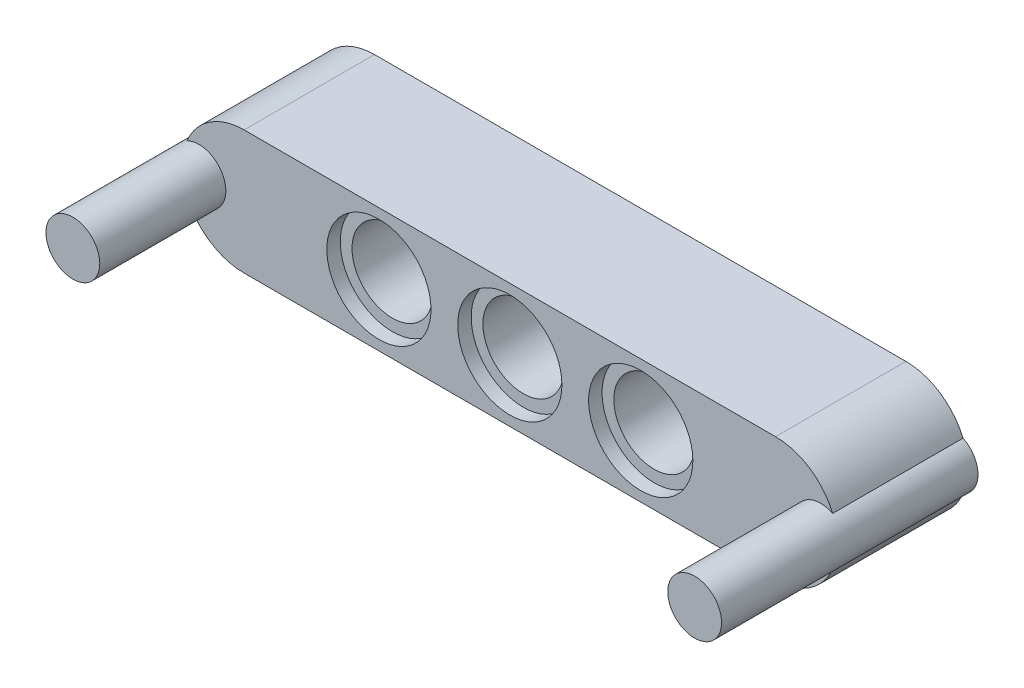
from build123d import *

# Parameters (mm, degrees)
SKETCH1_W                = 39
SKETCH1_H                = 7.38
BOSS_EXTRUDE1_DEPTH      = 7.76
SKETCH2_R                = 2.4
CUT_EXTRUDE1_DEPTH       = 7.76
CUT_EXTRUDE2_OUTLINE_R   = 3.1
CUT_EXTRUDE2_OUTLINE_R_2 = 2.4
CUT_EXTRUDE2_DEPTH       = 0.8
CUT_EXTRUDE3_START       = 6.96
CUT_EXTRUDE3_OUTLINE_R   = 3.1
CUT_EXTRUDE3_OUTLINE_R_2 = 2.4
CUT_EXTRUDE3_DEPTH       = 0.8
LPATTERN3_COUNT          = 3
LPATTERN3_PITCH          = 7.79
LPATTERN6_COUNT          = 3
LPATTERN6_PITCH          = 7.79
FILLET1_R                = 3.69
FILLET2_R                = 3.69
FILLET3_R                = 3.69
FILLET4_R                = 3.69
SKETCH3_R                = 3.1
BOSS_EXTRUDE2_DEPTH      = 7.76
BOSS_EXTRUDE3_START      = -7.76
SKETCH4_R                = 3.1
BOSS_EXTRUDE3_DEPTH      = 7.76
SKETCH6_R                = 1.6
BOSS_EXTRUDE4_DEPTH      = 7.5
SKETCH10_R               = 1.6
BOSS_EXTRUDE5_DEPTH      = 8


# Read off the part's stored shape, not the designer's step: Cut-Extrude2, Cut-Extrude3
with BuildPart() as part:
    # Sketch1 → Boss-Extrude1 (new body)
    with BuildSketch(Plane.XY):
        with Locations((19.5, 3.69)):
            Rectangle(SKETCH1_W, SKETCH1_H)
    extrude(amount=BOSS_EXTRUDE1_DEPTH)

    # Sketch2 → Cut-Extrude1 (cut)
    with BuildSketch(Plane.XY.offset(7.76)):
        with Locations((19.5, 3.69)):
            Circle(SKETCH2_R)
    cut_extrude1 = extrude(amount=-CUT_EXTRUDE1_DEPTH, mode=Mode.SUBTRACT)

    # Cut-Extrude2 outline → Cut-Extrude2 (cut)
    with BuildSketch(Plane.XY):
        with Locations((19.5, 3.69)):
            Circle(CUT_EXTRUDE2_OUTLINE_R)
        with Locations((19.5, 3.69)):
            Circle(CUT_EXTRUDE2_OUTLINE_R_2, mode=Mode.SUBTRACT)
    cut_extrude2 = extrude(amount=CUT_EXTRUDE2_DEPTH, mode=Mode.SUBTRACT)

    # Cut-Extrude3 outline → Cut-Extrude3 (cut)
    with BuildSketch(Plane.XY.offset(CUT_EXTRUDE3_START)):
        with Locations((19.5, 3.69)):
            Circle(CUT_EXTRUDE3_OUTLINE_R)
        with Locations((19.5, 3.69)):
            Circle(CUT_EXTRUDE3_OUTLINE_R_2, mode=Mode.SUBTRACT)
    cut_extrude3 = extrude(amount=CUT_EXTRUDE3_DEPTH, mode=Mode.SUBTRACT)

    # LPattern3: Cut-Extrude1, Cut-Extrude2, Cut-Extrude3 ×3
    with Locations(*[(-i * LPATTERN3_PITCH, 0, 0) for i in range(1, LPATTERN3_COUNT)]):
        add(cut_extrude1, mode=Mode.SUBTRACT)
        add(cut_extrude2, mode=Mode.SUBTRACT)
        add(cut_extrude3, mode=Mode.SUBTRACT)

    # LPattern6: Cut-Extrude1, Cut-Extrude2, Cut-Extrude3 ×3
    with Locations(*[(i * LPATTERN6_PITCH, 0, 0) for i in range(1, LPATTERN6_COUNT)]):
        add(cut_extrude1, mode=Mode.SUBTRACT)
        add(cut_extrude2, mode=Mode.SUBTRACT)
        add(cut_extrude3, mode=Mode.SUBTRACT)

    # Fillet1
    fillet1_edges = [part.edges().sort_by_distance(p)[0] for p in [
        (0, 7.38, 3.88),
    ]]
    fillet(fillet1_edges, radius=FILLET1_R)

    # Fillet2
    fillet2_edges = [part.edges().sort_by_distance(p)[0] for p in [
        (0, 0, 3.88),
    ]]
    fillet(fillet2_edges, radius=FILLET2_R - 0.0001)  # a hair under: the kernel refuses the full size

    # Fillet3
    fillet3_edges = [part.edges().sort_by_distance(p)[0] for p in [
        (39, 7.38, 3.88),
    ]]
    fillet(fillet3_edges, radius=FILLET3_R)

    # Fillet4
    fillet4_edges = [part.edges().sort_by_distance(p)[0] for p in [
        (39, 0, 3.88),
    ]]
    fillet(fillet4_edges, radius=FILLET4_R - 0.0001)  # a hair under: the kernel refuses the full size

    # Sketch3 → Boss-Extrude2 (add)
    with BuildSketch(Plane(origin=(0, 0, 0), x_dir=(-1, 0, 0), z_dir=(0, 0, -1))):
        with Locations((-35.08, 3.69)):
            Circle(SKETCH3_R)
    extrude(amount=-BOSS_EXTRUDE2_DEPTH)

    # Sketch4 → Boss-Extrude3 (add)
    with BuildSketch(Plane.XY.offset(7.76).offset(BOSS_EXTRUDE3_START)):
        with Locations((3.92, 3.69)):
            Circle(SKETCH4_R)
    extrude(amount=BOSS_EXTRUDE3_DEPTH)

    # Sketch6 → Boss-Extrude4 (add)
    with BuildSketch(Plane.XY.offset(7.76)):
        with Locations(Location((1, 3.69, 0), (0, 0, 243.655122674))):
            Circle(SKETCH6_R)
        with Locations(Location((38, 3.69, 0), (0, 0, 296.344877326))):
            Circle(SKETCH6_R)
    extrude(amount=BOSS_EXTRUDE4_DEPTH)

    # Sketch10 → Boss-Extrude5 (add)
    with BuildSketch(Plane(origin=(0, 0, 0), x_dir=(-1, 0, 0), z_dir=(0, 0, -1))):
        with Locations(Location((-38, 3.69, 0), (0, 0, 116.344877326))):
            Circle(SKETCH10_R)
        with Locations(Location((-1, 3.69, 0), (0, 0, 63.655122674))):
            Circle(SKETCH10_R)
    extrude(amount=-BOSS_EXTRUDE5_DEPTH)


solid = part.part
